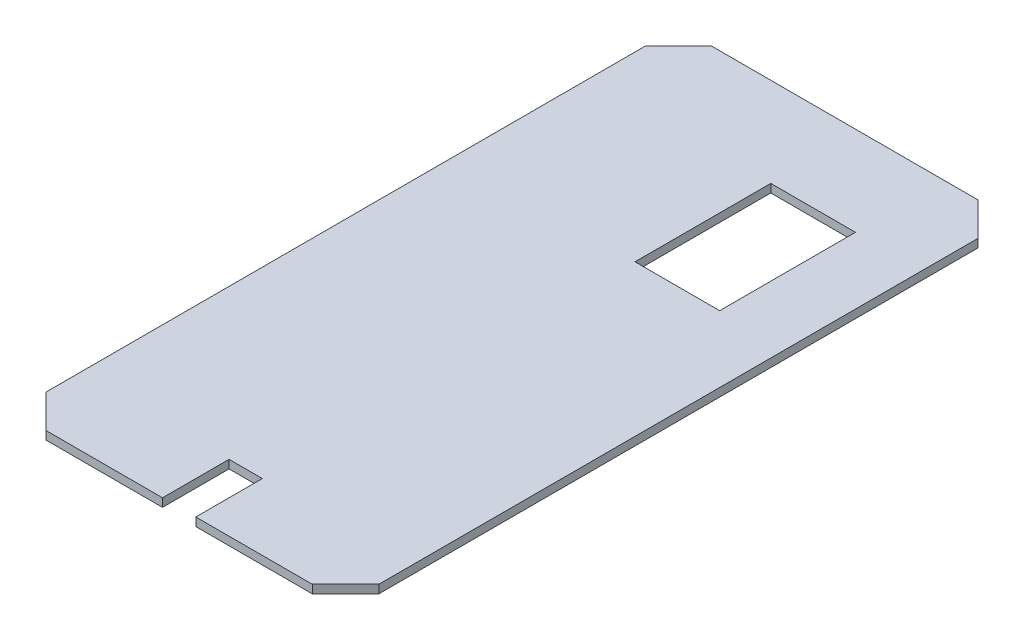
from build123d import *

# Parameters (mm, degrees)
SKETCH2_W           = 32.310298855
SKETCH2_H           = 51.805263964
BOSS_EXTRUDE1_DEPTH = 3.175


with BuildPart() as part:
    # Sketch2 → Boss-Extrude1 (new body)
    with BuildSketch(Plane(origin=(0, 0, 0), x_dir=(1, 0, 0), z_dir=(0, 1, 0))):
        Polygon((0, 241.3), (0, 12.7), (12.7, 0), (57.15, 0), (57.15, 25.4), (69.85, 25.4), (69.85, 0), (114.3, 0), (127, 12.7), (127, 241.3), (114.3, 254), (12.7, 254), align=None)
        with Locations((85.471887333, 194.016948732)):
            Rectangle(SKETCH2_W, SKETCH2_H, mode=Mode.SUBTRACT)
    extrude(amount=BOSS_EXTRUDE1_DEPTH)


solid = part.part
